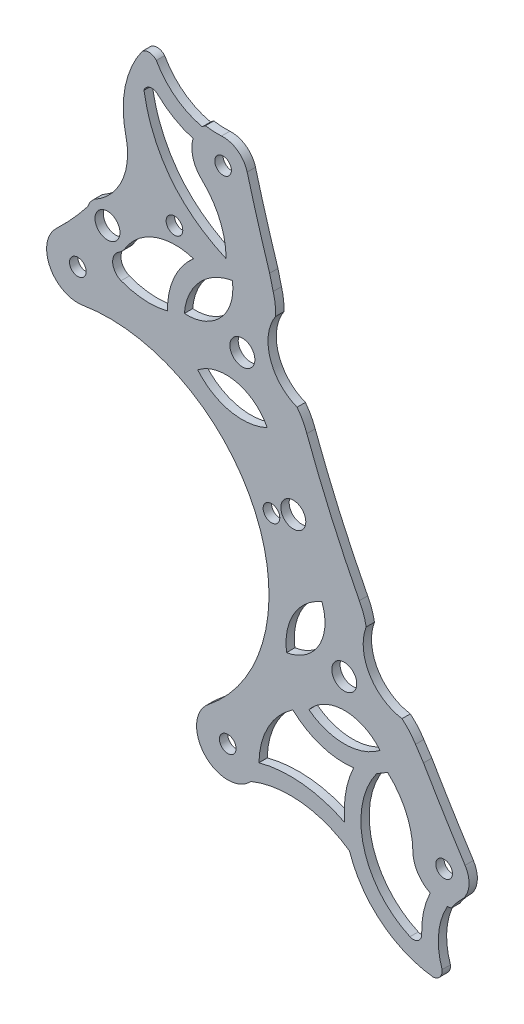
from build123d import *
from build123d.topology import SkipClean

# Parameters (mm, degrees)
SKETCH1_R            = 1.8
SKETCH1_R_2          = 2.75
EXTRUDE2_DEPTH       = 2
EXTRUDE3_START       = -2
EXTRUDE3_DEPTH       = 2
EXTRUDE4_DEPTH       = 2
EXTRUDE5_DEPTH       = 10
SKETCH5_R            = 3
EXTRUDE6_DEPTH       = 55
BOSS_EXTRUDE2_DEPTH  = 2
CUT_EXTRUDE2_DEPTH   = 10
BOSS_EXTRUDE3_DEPTH  = 2
CUT_EXTRUDE3_DEPTH   = 10
BOSS_EXTRUDE4_DEPTH  = 2
BOSS_EXTRUDE5_DEPTH  = 2
SKETCH11_R           = 3
CUT_EXTRUDE4_DEPTH   = 10
BOSS_EXTRUDE6_DEPTH  = 2
BOSS_EXTRUDE7_DEPTH  = 2
SKETCH16_R           = 3
SKETCH16_R_2         = 2
BOSS_EXTRUDE8_DEPTH  = 2
SKETCH16_3_R         = 2
CUT_EXTRUDE5_DEPTH   = 2
SKETCH17_R           = 2
CUT_EXTRUDE6_DEPTH   = 10
CUT_EXTRUDE7_DEPTH   = 10
CUT_EXTRUDE8_START   = -2
CUT_EXTRUDE8_DEPTH   = 2
BOSS_EXTRUDE9_DEPTH  = 2
SKETCH16_4_R         = 3
CUT_EXTRUDE9_DEPTH   = 2
SKETCH22_R           = 2
CUT_EXTRUDE11_DEPTH  = 10
SKETCH22_3_R         = 2
BOSS_EXTRUDE10_DEPTH = 2


# Read off the part's stored shape, not the designer's step: Cut-Extrude8
with BuildPart() as part:
    # Sketch1 → Extrude2 (new body)
    with BuildSketch(Plane.XY):
        with BuildLine():
            Line((214.950942091, 33.616874637), (221.807190432, 36.656917184))
            Line((221.807190432, 36.656917184), (220.185834407, 40.313582966))
            Line((220.185834407, 40.313582966), (249.033490074, 53.104557885))
            ThreePointArc((249.033490074, 53.104557885), (251.717229956, 54.156321533), (254.312398254, 52.901822418))
            Line((254.312398254, 52.901822418), (279.296283012, 23.753956867))
            ThreePointArc((279.296283012, 23.753956867), (280.042564492, 18.410715952), (275.5, 15.5))
            Line((275.5, 15.5), (223.5, 15.5))
            ThreePointArc((223.5, 15.5), (220.722148835, 16.342651938), (218.880602337, 18.586582838))
            Line((218.880602337, 18.586582838), (211.044169952, 36.260192904))
            Line((211.044169952, 36.260192904), (213.329586066, 37.27354042))
            Line((213.329586066, 37.27354042), (214.950942091, 33.616874637))
        make_face()
        with Locations((275.5, 20.5)):
            Circle(SKETCH1_R, mode=Mode.SUBTRACT)
        with Locations((251.5, 48.5)):
            Circle(SKETCH1_R_2, mode=Mode.SUBTRACT)
        with Locations((223.5, 20.5)):
            Circle(SKETCH1_R, mode=Mode.SUBTRACT)
    extrude(amount=EXTRUDE2_DEPTH)

    # Sketch2 → Extrude3 (add)
    with BuildSketch(Plane.XY.offset(2).offset(EXTRUDE3_START)):
        with BuildLine():
            Line((275.035821138, 64.633923334), (251.401662381, 54.15459928))
            ThreePointArc((251.401662381, 54.15459928), (253.0022869, 53.865703947), (254.312398254, 52.901822418))
            Line((254.312398254, 52.901822418), (265.867761021, 39.420565857))
            Line((265.867761021, 39.420565857), (282.872253523, 46.960313268))
            Line((282.872253523, 46.960313268), (275.035821138, 64.633923334))
        make_face()
        with BuildLine():
            Line((264.774418622, 15.5), (268.520870849, 7.050576522))
            Line((268.520870849, 7.050576522), (295.302771445, 18.925601058))
            Line((295.302771445, 18.925601058), (282.872253523, 46.960313268))
            Line((282.872253523, 46.960313268), (265.867761021, 39.420565857))
            Line((265.867761021, 39.420565857), (279.296283012, 23.753956867))
            ThreePointArc((279.296283012, 23.753956867), (280.042564492, 18.410715952), (275.5, 15.5))
            Line((275.5, 15.5), (264.774418622, 15.5))
        make_face()
        with BuildLine():
            ThreePointArc((223.5, 15.5), (222.085748932, 15.704179537), (220.787002315, 16.300042433))
            ThreePointArc((220.787002315, 16.300042433), (243.759401886, 7.058869787), (268.520870849, 7.050576522))
            Line((268.520870849, 7.050576522), (264.774418622, 15.5))
            Line((264.774418622, 15.5), (223.5, 15.5))
        make_face()
        with BuildLine():
            Line((295.302771445, 18.925601058), (268.520870849, 7.050576522))
            ThreePointArc((268.520870849, 7.050576522), (282.58749462, 11.46423343), (295.302771445, 18.925601058))
        make_face()
    extrude(amount=EXTRUDE3_DEPTH)


with BuildPart() as body_2:
    # Mirror2: mirrored copy
    add(part.part.mirror(Plane(origin=(11.104903497, -25.045036387, 0), x_dir=(0, 0, 1), z_dir=(-0.4053390061385553, 0.9141664455134023, 0))))


with BuildPart() as part_1:
    add(part.part)

    add(body_2.part)  # Extrude4 merges body 2
    # Sketch3 → Extrude4 (add)
    with BuildSketch(Plane.XY.offset(2)):
        Polygon((275.035821138, 64.633923334), (254.768870831, 110.34224561), (190.777219645, 81.96851518), (211.044169952, 36.260192904), align=None)
    extrude(amount=-EXTRUDE4_DEPTH)

    # Sketch4 → Extrude5 (cut)
    with BuildSketch(Plane.XY.offset(2)):
        Polygon((262.406775751, 78.177359931), (258.750109969, 76.556003907), (252.670024877, 90.26850059), (256.326690659, 91.889856614), align=None)
        Polygon((286.72711612, 23.327373201), (283.070450338, 21.706017176), (276.990365245, 35.418513859), (280.647031028, 37.039869883), align=None)
        Polygon((234.429769601, 131.405990638), (238.086435383, 133.027346662), (232.006350291, 146.739843345), (228.349684509, 145.11848732), align=None)
    extrude(amount=-EXTRUDE5_DEPTH, mode=Mode.SUBTRACT)

    # Sketch5 → Extrude6 (cut)
    with BuildSketch(Plane.XY.offset(2)):
        with Locations((239.255071404, 76.116150138)):
            Circle(SKETCH5_R)
    extrude(amount=-EXTRUDE6_DEPTH, mode=Mode.SUBTRACT)

    # Sketch8 → Boss-Extrude2 (add)
    with BuildSketch(Plane(origin=(0, 0, 0), x_dir=(-1, 0, 0), z_dir=(0, 0, -1))):
        Polygon((-198.724451181, 91.591049062), (-189.767325125, 87.770757271), (-210.762968813, 38.543986786), (-219.72009487, 42.364278577), align=None)
    extrude(amount=-BOSS_EXTRUDE2_DEPTH)

    # Sketch6 → Cut-Extrude2 (cut)
    with BuildSketch(Plane.XY.offset(2)):
        Polygon((215.30566699, 32.68026603), (222.161915332, 35.720308576), (220.540559307, 39.376974358), (213.684310966, 36.336931812), align=None)
    cut_extrude2 = extrude(amount=-CUT_EXTRUDE2_DEPTH, mode=Mode.SUBTRACT)

    # Mirror3: Cut-Extrude2 across plane
    add(cut_extrude2.mirror(Plane(origin=(11.104903497, -25.045036387, 0), x_dir=(0, 0, 1), z_dir=(-0.4053390061385553, 0.9141664455134023, 0))), mode=Mode.SUBTRACT)

    # Sketch7 → Boss-Extrude3 (add)
    with BuildSketch(Plane(origin=(0, 0, 0), x_dir=(-1, 0, 0), z_dir=(0, 0, -1))):
        Polygon((-211.798895028, 37.450463228), (-220.540559307, 42.086184193), (-224.569673151, 34.488410116), (-215.828008872, 29.852689152), align=None)
        Polygon((-222.161915332, 35.720308576), (-215.30566699, 32.68026603), (-213.684310966, 36.336931812), (-220.540559307, 39.376974358), align=None, mode=Mode.SUBTRACT)
    extrude(amount=-BOSS_EXTRUDE3_DEPTH)

    # Sketch9 → Cut-Extrude3 (cut)
    # profile 1 of 2: a face of its own
    with BuildSketch(Plane(origin=(0, 0, 0), x_dir=(-1, 0, 0), z_dir=(0, 0, -1))):
        with BuildLine():
            ThreePointArc((-219.146363738, 109.909757579), (-206.3092142, 102.916198704), (-192.4024525, 107.422222786))
            ThreePointArc((-192.4024525, 107.422222786), (-188.200798595, 109.244218974), (-183.723031197, 108.283404333))
            ThreePointArc((-183.723031197, 108.283404333), (-202.191395683, 139.524441278), (-234.501920524, 156.050567885))
            Line((-234.501920524, 156.050567885), (-295.302771445, 18.925601058))
            ThreePointArc((-295.302771445, 18.925601058), (-261.362042522, 6.076095375), (-225.809806958, 13.364539832))
            ThreePointArc((-225.809806958, 13.364539832), (-229.528237165, 16.037897729), (-230.998958431, 20.375010202))
            ThreePointArc((-230.998958431, 20.375010202), (-236.996576126, 33.706583992), (-250.798334924, 38.524647068))
            ThreePointArc((-250.798334924, 38.524647068), (-262.929674492, 32.795643116), (-268.001041569, 20.375010202))
            ThreePointArc((-268.001041569, 20.375010202), (-276.541032207, 13.072601267), (-282.744361441, 22.441449797))
            Line((-282.744361441, 22.441449797), (-283.070450338, 21.706017176))
            Line((-283.070450338, 21.706017176), (-286.72711612, 23.327373201))
            Line((-286.72711612, 23.327373201), (-280.647031028, 37.039869883))
            Line((-280.647031028, 37.039869883), (-276.990365245, 35.418513859))
            Line((-276.990365245, 35.418513859), (-281.802666507, 24.565266892))
            ThreePointArc((-281.802666507, 24.565266892), (-281.613064316, 24.845163365), (-281.411041354, 25.116231158))
            ThreePointArc((-281.411041354, 25.116231158), (-263.21115929, 51.627791867), (-248.39673574, 80.169540469))
            ThreePointArc((-248.39673574, 80.169540469), (-237.191011643, 110.311376626), (-229.762847648, 141.599088576))
            ThreePointArc((-229.762847648, 141.599088576), (-229.697599093, 141.930801784), (-229.617468339, 142.259237605))
            Line((-229.617468339, 142.259237605), (-234.429769601, 131.405990638))
            Line((-234.429769601, 131.405990638), (-238.086435383, 133.027346662))
            Line((-238.086435383, 133.027346662), (-232.006350291, 146.739843345))
            Line((-232.006350291, 146.739843345), (-228.349684509, 145.11848732))
            Line((-228.349684509, 145.11848732), (-228.675773406, 144.3830547))
            ThreePointArc((-228.675773406, 144.3830547), (-220.254144747, 147.512230066), (-214.873106899, 140.317787808))
            ThreePointArc((-214.873106899, 140.317787808), (-215.491764103, 137.334983534), (-217.245672588, 134.844268155))
            ThreePointArc((-217.245672588, 134.844268155), (-223.045618241, 122.746684929), (-219.146363738, 109.909757579))
        make_face()
        Polygon((-252.670024877, 90.26850059), (-258.750109969, 76.556003907), (-262.406775751, 78.177359931), (-256.326690659, 91.889856614), align=None, mode=Mode.SUBTRACT)
    # profile 2 of 2: a face of its own
    with BuildSketch(Plane(origin=(0, 0, 0), x_dir=(-1, 0, 0), z_dir=(0, 0, -1))):
        with BuildLine():
            ThreePointArc((-185.157297666, 94.64319988), (-186.908989848, 94.301155277), (-188.691901235, 94.382684405))
            ThreePointArc((-188.691901235, 94.382684405), (-213.220264161, 90.307475736), (-230.113406869, 72.062760256))
            ThreePointArc((-230.113406869, 72.062760256), (-232.292402054, 47.293830066), (-218.844160197, 26.379894193))
            ThreePointArc((-218.844160197, 26.379894193), (-217.586691658, 25.113326831), (-216.664091931, 23.585508204))
            Line((-216.664091931, 23.585508204), (-185.157297666, 94.64319988))
        make_face()
        Polygon((-215.30566699, 32.68026603), (-222.161915332, 35.720308576), (-220.540559307, 39.376974358), (-213.684310966, 36.336931812), align=None, mode=Mode.SUBTRACT)
        Polygon((-197.841574963, 90.570295307), (-190.985326622, 87.530252761), (-192.606682647, 83.873586979), (-199.462930988, 86.913629525), align=None, mode=Mode.SUBTRACT)
    extrude(amount=-CUT_EXTRUDE3_DEPTH, mode=Mode.SUBTRACT)

    # Sketch9<3> → Boss-Extrude4 (add)
    with SkipClean():  # the faces are left unmerged after this step: merging them gives an invalid solid
        with BuildSketch(Plane(origin=(0, 0, 0), x_dir=(-1, 0, 0), z_dir=(0, 0, -1))):
            with BuildLine():
                ThreePointArc((-179.960276728, 101.780866687), (-180.968769142, 105.537238508), (-183.723031197, 108.283404333))
                ThreePointArc((-183.723031197, 108.283404333), (-183.061079526, 105.450124932), (-182.526202408, 102.590132162))
                ThreePointArc((-182.526202408, 102.590132162), (-182.508998785, 101.084557319), (-182.94078726, 99.642125246))
                Line((-182.94078726, 99.642125246), (-185.157297666, 94.64319988))
                ThreePointArc((-185.157297666, 94.64319988), (-181.397177563, 97.366251356), (-179.960276728, 101.780866687))
            make_face()
            with BuildLine():
                ThreePointArc((-216, 20.5), (-216.167902397, 22.078082616), (-216.664091931, 23.585508204))
                Line((-216.664091931, 23.585508204), (-218.880602337, 18.586582838))
                ThreePointArc((-218.880602337, 18.586582838), (-219.659677978, 17.298136985), (-220.787001942, 16.300042674))
                ThreePointArc((-220.787001942, 16.300042674), (-223.265644053, 14.776236432), (-225.809806958, 13.364539832))
                ThreePointArc((-225.809806958, 13.364539832), (-219.088285605, 14.434789691), (-216, 20.5))
            make_face()
        extrude(amount=-BOSS_EXTRUDE4_DEPTH)

    # Sketch10 → Boss-Extrude5 (add)
    with SkipClean():  # the faces are left unmerged after this step: merging them gives an invalid solid
        with BuildSketch(Plane(origin=(0, 0, 0), x_dir=(-1, 0, 0), z_dir=(0, 0, -1))):
            with BuildLine():
                ThreePointArc((-235.958744639, 114.499032615), (-240.356731212, 107.959424354), (-240.525431642, 100.080318931))
                ThreePointArc((-240.525431642, 100.080318931), (-240.529519907, 96.974501167), (-242.511726994, 94.58348135))
                ThreePointArc((-242.511726994, 94.58348135), (-244.170042184, 109.167174091), (-234.418395851, 120.137110145))
                ThreePointArc((-234.418395851, 120.137110145), (-234.3000474, 117.07532284), (-235.958744639, 114.499032615))
            make_face()
            with BuildLine():
                ThreePointArc((-213.057679374, 104.885020596), (-211.080001731, 104.010099861), (-209.013751259, 103.371896019))
                ThreePointArc((-209.013751259, 103.371896019), (-212.855340343, 114.851723245), (-223.099104635, 121.302268415))
                ThreePointArc((-223.099104635, 121.302268415), (-222.968296994, 119.143661337), (-222.586531621, 117.015058425))
                ThreePointArc((-222.586531621, 117.015058425), (-216.000852002, 112.380740363), (-213.057679374, 104.885020596))
            make_face()
            with BuildLine():
                ThreePointArc((-239.150118611, 35.404946366), (-241.010369821, 36.507743079), (-242.986582803, 37.385967085))
                ThreePointArc((-242.986582803, 37.385967085), (-250.517668332, 34.534505934), (-258.373765711, 36.303633945))
                ThreePointArc((-258.373765711, 36.303633945), (-260.207579406, 35.157412985), (-261.895135861, 33.805063782))
                ThreePointArc((-261.895135861, 33.805063782), (-250.237002141, 30.544364773), (-239.150118611, 35.404946366))
            make_face()
            with BuildLine():
                ThreePointArc((-268.631422006, 42.976017735), (-261.826080652, 42.099863238), (-265.487264056, 47.902970486))
                ThreePointArc((-265.487264056, 47.902970486), (-263.593606182, 55.552991529), (-257.867708976, 60.968050465))
                ThreePointArc((-257.867708976, 60.968050465), (-255.684077657, 63.117539269), (-255.127631976, 66.130663239))
                ThreePointArc((-255.127631976, 66.130663239), (-267.048922235, 57.568131966), (-268.631422006, 42.976017735))
            make_face()
        extrude(amount=-BOSS_EXTRUDE5_DEPTH)

    # Sketch11 → Cut-Extrude4 (cut)
    with SkipClean():  # the faces are left unmerged after this step: merging them gives an invalid solid
        with BuildSketch(Plane(origin=(0, 0, 0), x_dir=(-1, 0, 0), z_dir=(0, 0, -1))):
            with Locations((-227.010142808, 103.732300275)):
                Circle(SKETCH11_R)
            with BuildLine():
                ThreePointArc((-213.058581143, 104.895884011), (-216.676051769, 113.177222848), (-224.599393661, 117.52317728))
                ThreePointArc((-224.599393661, 117.52317728), (-221.843097289, 108.454761562), (-213.058581143, 104.895884011))
            make_face()
            with BuildLine():
                ThreePointArc((-216.272267555, 94.74909177), (-225.503894125, 96.89627695), (-232.978230566, 91.068101583))
                ThreePointArc((-232.978230566, 91.068101583), (-223.997645443, 90.060253625), (-216.272267555, 94.74909177))
            make_face()
            with BuildLine():
                ThreePointArc((-240.158767208, 98.924631776), (-233.68343701, 105.845862315), (-234.993616715, 115.232915232))
                ThreePointArc((-234.993616715, 115.232915232), (-240.356731212, 107.959424354), (-240.158767208, 98.924631776))
            make_face()
        cut_extrude4 = extrude(amount=-CUT_EXTRUDE4_DEPTH, mode=Mode.SUBTRACT)

    # Sketch13 → Boss-Extrude6 (add)
    with BuildSketch(Plane(origin=(0, 0, 0), x_dir=(-1, 0, 0), z_dir=(0, 0, -1))):
        with BuildLine():
            ThreePointArc((-221.016225319, 141.500527161), (-218.054735197, 141.716298083), (-215.154232385, 142.351958587))
            ThreePointArc((-215.154232385, 142.351958587), (-216.00972223, 144.28733886), (-217.371744244, 145.906738657))
            ThreePointArc((-217.371744244, 145.906738657), (-222.057051315, 145.531261724), (-226.662688019, 146.469982035))
            ThreePointArc((-226.662688019, 146.469982035), (-227.771045753, 145.524730877), (-228.675773406, 144.3830547))
            Line((-228.675773406, 144.3830547), (-229.617468339, 142.259237605))
            ThreePointArc((-229.617468339, 142.259237605), (-229.697599093, 141.930801784), (-229.762847648, 141.599088576))
            ThreePointArc((-229.762847648, 141.599088576), (-231.865618613, 130.819291514), (-234.418395851, 120.137110145))
            Line((-234.418395851, 120.137110145), (-227.995019703, 140.663401272))
            ThreePointArc((-227.995019703, 140.663401272), (-227.083713367, 141.799635698), (-225.643399707, 142.016440843))
            ThreePointArc((-225.643399707, 142.016440843), (-224.61484051, 141.810023984), (-223.577174628, 141.655779176))
            ThreePointArc((-223.577174628, 141.655779176), (-222.264185757, 142.114489281), (-221.016225319, 141.500527161))
        make_face()
        with BuildLine():
            ThreePointArc((-203.346022961, 146.479774244), (-205.604715324, 129.417281213), (-220.281674353, 120.427440654))
            ThreePointArc((-220.281674353, 120.427440654), (-217.65856338, 119.112416082), (-215.283961995, 117.388679135))
            ThreePointArc((-215.283961995, 117.388679135), (-199.601215049, 132.738807559), (-202.957311315, 154.425476558))
            ThreePointArc((-202.957311315, 154.425476558), (-204.68739073, 155.016803958), (-206.328873231, 154.211584687))
            ThreePointArc((-206.328873231, 154.211584687), (-210.955849283, 148.869807849), (-217.371744244, 145.906738657))
            ThreePointArc((-217.371744244, 145.906738657), (-216.00972223, 144.28733886), (-215.154232385, 142.351958587))
            ThreePointArc((-215.154232385, 142.351958587), (-210.596914714, 144.316170629), (-206.635274013, 147.304928943))
            ThreePointArc((-206.635274013, 147.304928943), (-204.76208278, 147.803465588), (-203.346022961, 146.479774244))
        make_face()
    boss_extrude6 = extrude(amount=-BOSS_EXTRUDE6_DEPTH)

    # Sketch14 → Boss-Extrude7 (add)
    with SkipClean():  # the faces are left unmerged after this step: merging them gives an invalid solid
        with BuildSketch(Plane(origin=(0, 0, 0), x_dir=(-1, 0, 0), z_dir=(0, 0, -1))):
            with BuildLine():
                Line((-204.620489613, 124.167104246), (-201.438511078, 128.5814043))
                ThreePointArc((-201.438511078, 128.5814043), (-196.896529827, 117.158820126), (-187.460276728, 109.280866687))
                Line((-187.460276728, 109.280866687), (-192.367992506, 107.452226827))
                ThreePointArc((-192.367992506, 107.452226827), (-200.038082842, 114.677984071), (-204.620489613, 124.167104246))
            make_face()
        boss_extrude7 = extrude(amount=-BOSS_EXTRUDE7_DEPTH)

    # Mirror5: Cut-Extrude4, Boss-Extrude6, Boss-Extrude7 across plane
    with SkipClean():  # the faces are left unmerged after this step: merging them gives an invalid solid
        add(cut_extrude4.mirror(Plane(origin=(11.104903497, -25.045036387, 0), x_dir=(0, 0, 1), z_dir=(-0.4053390061385553, 0.9141664455134023, 0))), mode=Mode.SUBTRACT)
        add(boss_extrude6.mirror(Plane(origin=(11.104903497, -25.045036387, 0), x_dir=(0, 0, 1), z_dir=(-0.4053390061385553, 0.9141664455134023, 0))))
        add(boss_extrude7.mirror(Plane(origin=(11.104903497, -25.045036387, 0), x_dir=(0, 0, 1), z_dir=(-0.4053390061385553, 0.9141664455134023, 0))))

    # Sketch16 → Boss-Extrude8 (add)
    with SkipClean():  # the faces are left unmerged after this step: merging them gives an invalid solid
        with BuildSketch(Plane(origin=(0, 0, 0), x_dir=(-1, 0, 0), z_dir=(0, 0, -1))):
            with Locations((-194.583275689, 113.954740729)):
                Circle(SKETCH16_R)
            with Locations((-194.583275689, 113.954740729)):
                Circle(SKETCH16_R_2, mode=Mode.SUBTRACT)
        extrude(amount=-BOSS_EXTRUDE8_DEPTH)

    # Sketch16<3> → Cut-Extrude5 (cut)
    with SkipClean():  # the faces are left unmerged after this step: merging them gives an invalid solid
        with BuildSketch(Plane(origin=(0, 0, 0), x_dir=(-1, 0, 0), z_dir=(0, 0, -1))):
            with Locations((-194.583275689, 113.954740729)):
                Circle(SKETCH16_3_R)
        extrude(amount=-CUT_EXTRUDE5_DEPTH, mode=Mode.SUBTRACT)

    # Sketch17 → Cut-Extrude6 (cut)
    with SkipClean():  # the faces are left unmerged after this step: merging them gives an invalid solid
        with BuildSketch(Plane(origin=(0, 0, 0), x_dir=(-1, 0, 0), z_dir=(0, 0, -1))):
            with Locations((-187.460276728, 101.780866687)):
                Circle(SKETCH17_R)
            with Locations((-222.373106899, 140.317787808)):
                Circle(SKETCH17_R)
            with Locations((-223.5, 20.5)):
                Circle(SKETCH17_R)
            with Locations((-275.5, 20.5)):
                Circle(SKETCH17_R)
        extrude(amount=-CUT_EXTRUDE6_DEPTH, mode=Mode.SUBTRACT)

    # Sketch18 → Cut-Extrude7 (cut)
    with SkipClean():  # the faces are left unmerged after this step: merging them gives an invalid solid
        with BuildSketch(Plane(origin=(0, 0, 0), x_dir=(-1, 0, 0), z_dir=(0, 0, -1))):
            with BuildLine():
                Line((-268.631422006, 42.976017735), (-277.444270288, 63.909399485))
                Line((-277.444270288, 63.909399485), (-255.127631976, 66.130663239))
                ThreePointArc((-255.127631976, 66.130663239), (-256.139347113, 63.869294952), (-256.76505671, 61.472246445))
                ThreePointArc((-256.76505671, 61.472246445), (-257.546803091, 52.026495764), (-265.383153079, 46.694990142))
                ThreePointArc((-265.383153079, 46.694990142), (-267.161368211, 44.970082901), (-268.631422006, 42.976017735))
            make_face()
            with BuildLine():
                Line((-234.418395851, 120.137110145), (-250.480120627, 122.495780878))
                Line((-250.480120627, 122.495780878), (-261.715098887, 98.301383812))
                Line((-261.715098887, 98.301383812), (-242.511726994, 94.58348135))
                ThreePointArc((-242.511726994, 94.58348135), (-241.515105214, 96.851541991), (-240.158767208, 98.924631776))
                ThreePointArc((-240.158767208, 98.924631776), (-233.68343701, 105.845862315), (-234.993616715, 115.232915232))
                ThreePointArc((-234.993616715, 115.232915232), (-234.909191881, 117.708844652), (-234.418395851, 120.137110145))
            make_face()
        extrude(amount=-CUT_EXTRUDE7_DEPTH, mode=Mode.SUBTRACT)

    # Cut-Extrude8 outline → Cut-Extrude8 (cut)
    with SkipClean():  # the faces are left unmerged after this step: merging them gives an invalid solid
        with BuildSketch(Plane(origin=(0, 0, 0), x_dir=(-1, 0, 0), z_dir=(0, 0, -1)).offset(CUT_EXTRUDE8_START)):
            with BuildLine():
                ThreePointArc((-279.694653694, 16.209909047), (-281.462322543, 19.828650694), (-280.543643076, 23.749871462))
                ThreePointArc((-280.543643076, 23.749871462), (-275.4564309, 31.856211166), (-270.555297774, 40.07639153))
                ThreePointArc((-270.555297774, 40.07639153), (-275.851180504, 32.500534336), (-281.411041354, 25.116231158))
                ThreePointArc((-281.411041354, 25.116231158), (-281.613064316, 24.845163364), (-281.802666507, 24.565266892))
                Line((-281.802666507, 24.565266892), (-282.744361441, 22.441449797))
                ThreePointArc((-282.744361441, 22.441449797), (-281.952469183, 16.676959136), (-277.276884943, 13.213527609))
                ThreePointArc((-277.276884943, 13.213527609), (-278.39748836, 14.782951896), (-279.694653694, 16.209909047))
            make_face()
            with BuildLine():
                ThreePointArc((-229.762847648, 141.599088576), (-231.50242133, 132.520880079), (-233.561189729, 123.509694875))
                ThreePointArc((-233.561189729, 123.509694875), (-230.759416419, 132.662516724), (-228.167015875, 141.876828468))
                ThreePointArc((-228.167015875, 141.876828468), (-225.877339968, 145.188142066), (-222.010036425, 146.306792719))
                ThreePointArc((-222.010036425, 146.306792719), (-220.081608576, 146.303530306), (-218.166142869, 146.5267695))
                ThreePointArc((-218.166142869, 146.5267695), (-223.872063371, 147.666469968), (-228.675773406, 144.3830547))
                Line((-228.675773406, 144.3830547), (-229.617468339, 142.259237605))
                ThreePointArc((-229.617468339, 142.259237605), (-229.697599093, 141.930801784), (-229.762847648, 141.599088576))
            make_face()
        extrude(amount=CUT_EXTRUDE8_DEPTH, mode=Mode.SUBTRACT)

    # Sketch20 → Boss-Extrude9 (add)
    with SkipClean():  # the faces are left unmerged after this step: merging them gives an invalid solid
        with BuildSketch(Plane(origin=(0, 0, 0), x_dir=(-1, 0, 0), z_dir=(0, 0, -1))):
            with BuildLine():
                ThreePointArc((-187.460276728, 109.280866687), (-184.686287803, 108.749007432), (-182.305731327, 107.228862806))
                ThreePointArc((-182.305731327, 107.228862806), (-186.231180938, 111.237719227), (-189.839354683, 115.534365207))
                ThreePointArc((-189.839354683, 115.534365207), (-190.477305487, 116.807986022), (-191.448511813, 117.850027039))
                ThreePointArc((-191.448511813, 117.850027039), (-198.092467353, 125.055925882), (-199.012702848, 134.814014321))
                ThreePointArc((-199.012702848, 134.814014321), (-200.007438782, 131.61279558), (-201.438511078, 128.5814043))
                ThreePointArc((-201.438511078, 128.5814043), (-199.700265161, 122.145954162), (-196.323461832, 116.398457608))
                ThreePointArc((-196.323461832, 116.398457608), (-192.457978423, 116.072076681), (-192.146106925, 112.20539559))
                ThreePointArc((-192.146106925, 112.20539559), (-189.884193343, 110.613346353), (-187.460276728, 109.280866687))
            make_face()
            with BuildLine():
                ThreePointArc((-197.289456843, 109.750387799), (-195.844770664, 106.757541927), (-197.852303232, 104.109135319))
                ThreePointArc((-197.852303232, 104.109135319), (-194.983556151, 105.529100064), (-192.4024525, 107.422222786))
                ThreePointArc((-192.4024525, 107.422222786), (-192.385245352, 107.437251049), (-192.367992506, 107.452226827))
                ThreePointArc((-192.367992506, 107.452226827), (-200.038082842, 114.677984071), (-204.620489613, 124.167104246))
                ThreePointArc((-204.620489613, 124.167104246), (-209.446870241, 120.096205133), (-215.167902853, 117.42488422))
                ThreePointArc((-215.167902853, 117.42488422), (-205.958102249, 117.184652604), (-198.841389813, 111.333965251))
                ThreePointArc((-198.841389813, 111.333965251), (-198.154309372, 110.455066682), (-197.289456843, 109.750387799))
            make_face()
        extrude(amount=-BOSS_EXTRUDE9_DEPTH)

    # Sketch16<4> → Cut-Extrude9 (cut)
    with SkipClean():  # the faces are left unmerged after this step: merging them gives an invalid solid
        with BuildSketch(Plane(origin=(0, 0, 0), x_dir=(-1, 0, 0), z_dir=(0, 0, -1))):
            with Locations((-194.583275689, 113.954740729)):
                Circle(SKETCH16_4_R)
        extrude(amount=-CUT_EXTRUDE9_DEPTH, mode=Mode.SUBTRACT)

    # Sketch22 → Cut-Extrude11 (cut)
    with SkipClean():  # the faces are left unmerged after this step: merging them gives an invalid solid
        with BuildSketch(Plane.XY.offset(2)):
            with Locations((210.684885935, 122.000742684)):
                Circle(SKETCH22_R)
            with Locations((234.005775534, 73.788626106)):
                Circle(SKETCH22_R)
        extrude(amount=-CUT_EXTRUDE11_DEPTH, mode=Mode.SUBTRACT)

    # Sketch22<3> → Boss-Extrude10 (add)
    with SkipClean():  # the faces are left unmerged after this step: merging them gives an invalid solid
        with BuildSketch(Plane.XY.offset(2)):
            with BuildLine():
                Line((223.099104635, 121.302268415), (218.334856534, 118.070158091))
                Line((218.334856534, 118.070158091), (213.798003088, 120.401211005))
                ThreePointArc((213.798003088, 120.401211005), (208.798729171, 119.052452898), (207.927734777, 124.156692008))
                Line((207.927734777, 124.156692008), (199.936400139, 138.955212966))
                Line((199.936400139, 138.955212966), (203.346022961, 146.479774244))
                add(Edge.make_bspline(
                    [(223.099104635, 121.302268415), (206.486242432, 128.655244288), (203.346022961, 146.479774244)],
                    knots=[0, 0, 0, 1, 1, 1], degree=2))
            make_face()
            with Locations((210.684885935, 122.000742684)):
                Circle(SKETCH22_3_R, mode=Mode.SUBTRACT)
        extrude(amount=-BOSS_EXTRUDE10_DEPTH)


solid = part_1.part
